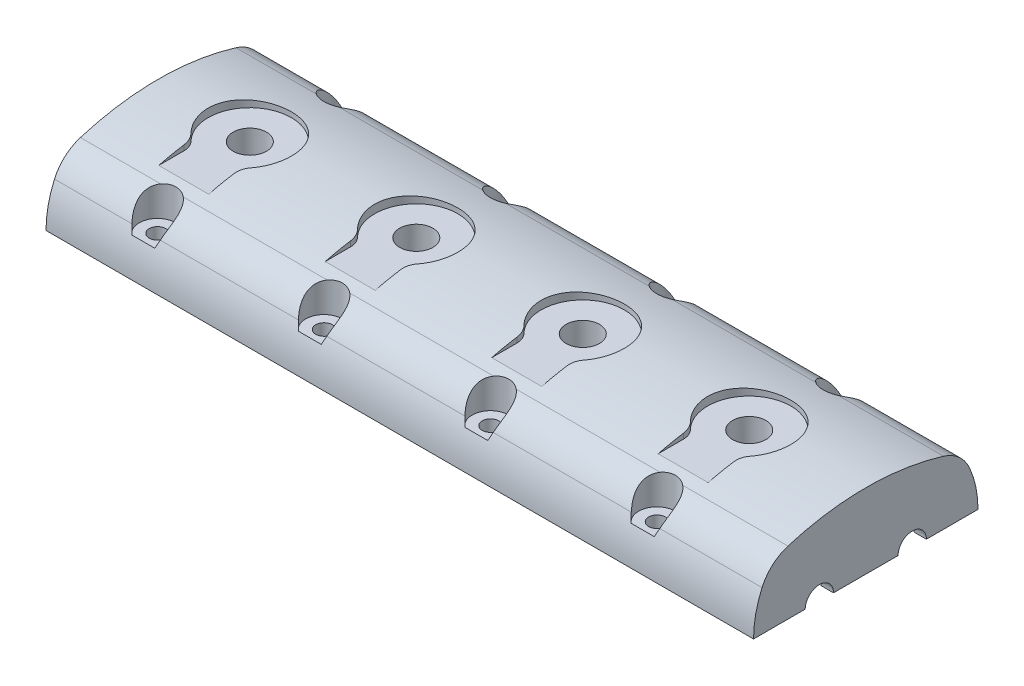
from build123d import *

# Parameters (mm, degrees)
BOSS_EXTRUDE1_DEPTH      = 212.5
BOSS_EXTRUDE1_DEPTH_BACK = 212.5
SHELL1_T                 = -7.5
BOSS_EXTRUDE2_REACH      = 229.432
SKETCH2_R                = 12
BOSS_EXTRUDE4_REACH      = 229.432
SKETCH12_R               = 12
BOSS_EXTRUDE5_DEPTH      = 212
BOSS_EXTRUDE5_DEPTH_BACK = 212
SKETCH3_R                = 11
CUT_EXTRUDE1_DEPTH       = 225.332611468
F_10_0MM_DOWEL_HOLE3_D   = 10
SKETCH18_R               = 12.5
SKETCH18_R_2             = 10
BOSS_EXTRUDE6_DEPTH      = 30
SKETCH19_R               = 10
CUT_EXTRUDE3_DEPTH       = 228.431573519
SKETCH20_W               = 7.5
SKETCH20_H               = 119.816476268
BOSS_EXTRUDE7_DEPTH      = 30
BOSS_EXTRUDE7_2_DEPTH    = 30
BOSS_EXTRUDE7_3_DEPTH    = 30
SPLIT1_START             = 88.75
SPLIT1_DEPTH             = 7.5
SPLIT1_START_2           = -11.25
SPLIT1_2_DEPTH           = 7.5
SPLIT1_START_3           = -111.25
SPLIT1_3_DEPTH           = 7.5
CUT_EXTRUDE2_DEPTH       = 228.431573519
CUT_EXTRUDE2_DEPTH_BACK  = 228.431573519
SKETCH16_R               = 8.5
CUT_EXTRUDE4_DEPTH       = 227.49529936


# Read off the part's stored shape, not the designer's step: Split1
with BuildPart() as part:
    # Sketch1 → Boss-Extrude1 (new, two sides: drawn at the far end of the back side and taken through both)
    with BuildSketch(Plane(origin=(0, 0, 0), x_dir=(0, 0, -1), z_dir=(1, 0, 0)).offset(-BOSS_EXTRUDE1_DEPTH_BACK)):
        with BuildLine():
            Line((-67.408238134, 0), (67.408238134, 0))
            ThreePointArc((67.408238134, 0), (66.121281258, 12.360362739), (62.315619233, 24.190483684))
            ThreePointArc((62.315619233, 24.190483684), (56.03712161, 32.804804676), (46.740792622, 38.020581312))
            ThreePointArc((46.740792622, 38.020581312), (0, 45), (-46.740792622, 38.020581312))
            ThreePointArc((-46.740792622, 38.020581312), (-56.03712161, 32.804804676), (-62.315619233, 24.190483684))
            ThreePointArc((-62.315619233, 24.190483684), (-66.121281258, 12.360362739), (-67.408238134, 0))
        make_face()
    extrude(amount=BOSS_EXTRUDE1_DEPTH + BOSS_EXTRUDE1_DEPTH_BACK)

    # Shell1
    shell1_openings = [part.faces().sort_by_distance(p)[0] for p in [
        (0, 0, 0),
    ]]
    offset(amount=SHELL1_T, openings=shell1_openings, kind=Kind.INTERSECTION)

    # Sketch2 → Boss-Extrude2 (add, up to next)
    with BuildSketch(Plane(origin=(0, 0, 0), x_dir=(1, 0, 0), z_dir=(0, 1, 0)), mode=Mode.PRIVATE) as boss_extrude2_sk1:
        with Locations((-157.5, -55.408238134)):
            Circle(SKETCH2_R)
    boss_extrude2_tool1 = extrude(boss_extrude2_sk1.sketch, amount=BOSS_EXTRUDE2_REACH, mode=Mode.PRIVATE) - part.part
    # Sketch2 → Boss-Extrude2 (add, up to next)
    with BuildSketch(Plane(origin=(0, 0, 0), x_dir=(1, 0, 0), z_dir=(0, 1, 0)), mode=Mode.PRIVATE) as boss_extrude2_sk2:
        with Locations((-57.5, -55.408238134)):
            Circle(SKETCH2_R)
    boss_extrude2_tool2 = extrude(boss_extrude2_sk2.sketch, amount=BOSS_EXTRUDE2_REACH, mode=Mode.PRIVATE) - part.part
    # Sketch2 → Boss-Extrude2 (add, up to next)
    with BuildSketch(Plane(origin=(0, 0, 0), x_dir=(1, 0, 0), z_dir=(0, 1, 0)), mode=Mode.PRIVATE) as boss_extrude2_sk3:
        with Locations((42.5, -55.408238134)):
            Circle(SKETCH2_R)
    boss_extrude2_tool3 = extrude(boss_extrude2_sk3.sketch, amount=BOSS_EXTRUDE2_REACH, mode=Mode.PRIVATE) - part.part
    # Sketch2 → Boss-Extrude2 (add, up to next)
    with BuildSketch(Plane(origin=(0, 0, 0), x_dir=(1, 0, 0), z_dir=(0, 1, 0)), mode=Mode.PRIVATE) as boss_extrude2_sk4:
        with Locations((142.5, -55.408238134)):
            Circle(SKETCH2_R)
    boss_extrude2_tool4 = extrude(boss_extrude2_sk4.sketch, amount=BOSS_EXTRUDE2_REACH, mode=Mode.PRIVATE) - part.part
    add(boss_extrude2_tool1.solids().sort_by_distance((-157.5, 0, 55.408238))[0])
    add(boss_extrude2_tool2.solids().sort_by_distance((-57.5, 0, 55.408238))[0])
    add(boss_extrude2_tool3.solids().sort_by_distance((42.5, 0, 55.408238))[0])
    add(boss_extrude2_tool4.solids().sort_by_distance((142.5, 0, 55.408238))[0])

    # Sketch12 → Boss-Extrude4 (add, up to next)
    with BuildSketch(Plane.XZ, mode=Mode.PRIVATE) as boss_extrude4_sk1:
        with Locations((-157.5, -55.408238134)):
            Circle(SKETCH12_R)
    boss_extrude4_tool1 = extrude(boss_extrude4_sk1.sketch, amount=-BOSS_EXTRUDE4_REACH, mode=Mode.PRIVATE) - part.part
    # Sketch12 → Boss-Extrude4 (add, up to next)
    with BuildSketch(Plane.XZ, mode=Mode.PRIVATE) as boss_extrude4_sk2:
        with Locations((-57.5, -55.408238134)):
            Circle(SKETCH12_R)
    boss_extrude4_tool2 = extrude(boss_extrude4_sk2.sketch, amount=-BOSS_EXTRUDE4_REACH, mode=Mode.PRIVATE) - part.part
    # Sketch12 → Boss-Extrude4 (add, up to next)
    with BuildSketch(Plane.XZ, mode=Mode.PRIVATE) as boss_extrude4_sk3:
        with Locations((42.5, -55.408238134)):
            Circle(SKETCH12_R)
    boss_extrude4_tool3 = extrude(boss_extrude4_sk3.sketch, amount=-BOSS_EXTRUDE4_REACH, mode=Mode.PRIVATE) - part.part
    # Sketch12 → Boss-Extrude4 (add, up to next)
    with BuildSketch(Plane.XZ, mode=Mode.PRIVATE) as boss_extrude4_sk4:
        with Locations((142.5, -55.408238134)):
            Circle(SKETCH12_R)
    boss_extrude4_tool4 = extrude(boss_extrude4_sk4.sketch, amount=-BOSS_EXTRUDE4_REACH, mode=Mode.PRIVATE) - part.part
    add(boss_extrude4_tool1.solids().sort_by_distance((-157.5, 0, -55.408238))[0])
    add(boss_extrude4_tool2.solids().sort_by_distance((-57.5, 0, -55.408238))[0])
    add(boss_extrude4_tool3.solids().sort_by_distance((42.5, 0, -55.408238))[0])
    add(boss_extrude4_tool4.solids().sort_by_distance((142.5, 0, -55.408238))[0])

    # Sketch17 → Boss-Extrude5 (add, two sides: drawn at the far end of the back side and taken through both)
    with BuildSketch(Plane(origin=(0, 0, 0), x_dir=(0, 0, -1), z_dir=(1, 0, 0)).offset(-BOSS_EXTRUDE5_DEPTH_BACK)):
        Polygon((-44.408238134, 36.314981565), (-52.528779147, 30), (52.528779147, 30), (44.408238134, 36.314981565), (0, 42.549434784), align=None)
    extrude(amount=BOSS_EXTRUDE5_DEPTH + BOSS_EXTRUDE5_DEPTH_BACK)

    # Sketch3 → Cut-Extrude1 (cut, through all)
    with BuildSketch(Plane(origin=(0, 20, 0), x_dir=(1, 0, 0), z_dir=(0, 1, 0))):
        with Locations((142.5, -55.408238134)):
            Circle(SKETCH3_R)
        with Locations((-157.5, -55.408238134)):
            Circle(SKETCH3_R)
        with Locations((-57.5, -55.408238134)):
            Circle(SKETCH3_R)
        with Locations((42.5, -55.408238134)):
            Circle(SKETCH3_R)
        with Locations((42.5, 55.408238134)):
            Circle(SKETCH3_R)
        with Locations((-57.5, 55.408238134)):
            Circle(SKETCH3_R)
        with Locations((-157.5, 55.408238134)):
            Circle(SKETCH3_R)
        with Locations((142.5, 55.408238134)):
            Circle(SKETCH3_R)
    extrude(amount=CUT_EXTRUDE1_DEPTH, mode=Mode.SUBTRACT)

    # Ø10.0mm Dowel Hole3 (through all)
    with Locations(Plane(origin=(0, 0, 0), x_dir=(-1, 0, 0), z_dir=(0, -1, 0))):
        with Locations((157.5, -55.408238134), (57.5, -55.408238134), (-42.5, -55.408238134), (-142.5, -55.408238134), (-142.5, 55.408238134), (-42.5, 55.408238134), (57.5, 55.408238134), (157.5, 55.408238134)):
            Hole(F_10_0MM_DOWEL_HOLE3_D / 2)

    # Sketch18 → Boss-Extrude6 (add)
    # profile 1 of 4: a face of its own
    with BuildSketch(Plane(origin=(0, 0, 0), x_dir=(1, 0, 0), z_dir=(0, 1, 0))):
        with Locations(Location((-157.5, 0, 0), (0, 0, 90))):
            Circle(SKETCH18_R)
        with Locations(Location((-157.5, 0, 0), (0, 0, 90))):
            Circle(SKETCH18_R_2, mode=Mode.SUBTRACT)
    # profile 2 of 4: a face of its own
    with BuildSketch(Plane(origin=(0, 0, 0), x_dir=(1, 0, 0), z_dir=(0, 1, 0))):
        with Locations(Location((-57.5, 0, 0), (0, 0, 90))):
            Circle(SKETCH18_R)
        with Locations(Location((-57.5, 0, 0), (0, 0, 90))):
            Circle(SKETCH18_R_2, mode=Mode.SUBTRACT)
    # profile 3 of 4: a face of its own
    with BuildSketch(Plane(origin=(0, 0, 0), x_dir=(1, 0, 0), z_dir=(0, 1, 0))):
        with Locations(Location((42.5, 0, 0), (0, 0, 90))):
            Circle(SKETCH18_R)
        with Locations(Location((42.5, 0, 0), (0, 0, 90))):
            Circle(SKETCH18_R_2, mode=Mode.SUBTRACT)
    # profile 4 of 4: a face of its own
    with BuildSketch(Plane(origin=(0, 0, 0), x_dir=(1, 0, 0), z_dir=(0, 1, 0))):
        with Locations(Location((142.5, 0, 0), (0, 0, 90))):
            Circle(SKETCH18_R)
        with Locations(Location((142.5, 0, 0), (0, 0, 90))):
            Circle(SKETCH18_R_2, mode=Mode.SUBTRACT)
    extrude(amount=BOSS_EXTRUDE6_DEPTH)

    # Sketch19 → Cut-Extrude3 (cut, through all)
    with BuildSketch(Plane(origin=(0, 0, 0), x_dir=(1, 0, 0), z_dir=(0, 1, 0))):
        with Locations((-157.5, 0)):
            Circle(SKETCH19_R)
        with Locations((-57.5, 0)):
            Circle(SKETCH19_R)
        with Locations((42.5, 0)):
            Circle(SKETCH19_R)
        with Locations((142.5, 0)):
            Circle(SKETCH19_R)
    extrude(amount=CUT_EXTRUDE3_DEPTH, mode=Mode.SUBTRACT)


with BuildPart() as body_2:
    # Sketch20 → Boss-Extrude7 (new body)
    with BuildSketch(Plane(origin=(0, 0, 0), x_dir=(1, 0, 0), z_dir=(0, 1, 0))):
        with Locations((-107.5, 0)):
            Rectangle(SKETCH20_W, SKETCH20_H)
    extrude(amount=BOSS_EXTRUDE7_DEPTH)

    # Split1 3 outline → Split1 3 (cut)
    with BuildSketch(Plane.YZ.offset(SPLIT1_START_3)):
        with BuildLine():
            Line((30, -59.908238134), (30, -58.738925818))
            ThreePointArc((30, -58.738925818), (29.242348026, -59.338443294), (28.462097067, -59.908238134))
            Line((28.462097067, -59.908238134), (30, -59.908238134))
        make_face()
        with BuildLine():
            ThreePointArc((28.462097067, 59.908238134), (29.242348026, 59.338443294), (30, 58.738925818))
            Line((30, 58.738925818), (30, 59.908238134))
            Line((30, 59.908238134), (28.462097067, 59.908238134))
        make_face()
    extrude(amount=SPLIT1_3_DEPTH, mode=Mode.SUBTRACT)


with BuildPart() as body_3:
    # Sketch20 → Boss-Extrude7 2 (new body)
    with BuildSketch(Plane(origin=(0, 0, 0), x_dir=(1, 0, 0), z_dir=(0, 1, 0))):
        with Locations((-7.5, 0)):
            Rectangle(SKETCH20_W, SKETCH20_H)
    extrude(amount=BOSS_EXTRUDE7_2_DEPTH)

    # Split1 2 outline → Split1 2 (cut)
    with BuildSketch(Plane.YZ.offset(SPLIT1_START_2)):
        with BuildLine():
            Line((30, -59.908238134), (30, -58.738925818))
            ThreePointArc((30, -58.738925818), (29.242348026, -59.338443294), (28.462097067, -59.908238134))
            Line((28.462097067, -59.908238134), (30, -59.908238134))
        make_face()
        with BuildLine():
            ThreePointArc((28.462097067, 59.908238134), (29.242348026, 59.338443294), (30, 58.738925818))
            Line((30, 58.738925818), (30, 59.908238134))
            Line((30, 59.908238134), (28.462097067, 59.908238134))
        make_face()
    extrude(amount=SPLIT1_2_DEPTH, mode=Mode.SUBTRACT)


with BuildPart() as body_4:
    # Sketch20 → Boss-Extrude7 3 (new body)
    with BuildSketch(Plane(origin=(0, 0, 0), x_dir=(1, 0, 0), z_dir=(0, 1, 0))):
        with Locations((92.5, 0)):
            Rectangle(SKETCH20_W, SKETCH20_H)
    extrude(amount=BOSS_EXTRUDE7_3_DEPTH)

    # Split1 outline → Split1 (cut)
    with BuildSketch(Plane.YZ.offset(SPLIT1_START)):
        with BuildLine():
            Line((30, -59.908238134), (30, -58.738925818))
            ThreePointArc((30, -58.738925818), (29.242348026, -59.338443294), (28.462097067, -59.908238134))
            Line((28.462097067, -59.908238134), (30, -59.908238134))
        make_face()
        with BuildLine():
            ThreePointArc((28.462097067, 59.908238134), (29.242348026, 59.338443294), (30, 58.738925818))
            Line((30, 58.738925818), (30, 59.908238134))
            Line((30, 59.908238134), (28.462097067, 59.908238134))
        make_face()
    extrude(amount=SPLIT1_DEPTH, mode=Mode.SUBTRACT)


with BuildPart() as part_1:
    add(part.part)

    # Combine1: union body 2, body 3, body 4
    add(body_2.part)
    add(body_3.part)
    add(body_4.part)

    # Sketch16 → Cut-Extrude2 (cut, two sides: drawn at the far end of the back side and taken through both)
    with BuildSketch(Plane(origin=(0, 0, 0), x_dir=(0, 0, -1), z_dir=(1, 0, 0)).offset(-CUT_EXTRUDE2_DEPTH_BACK)):
        with Locations((27.896972929, 0)):
            Circle(SKETCH16_R)
        with Locations((-27.896972929, 0)):
            Circle(SKETCH16_R)
    extrude(amount=CUT_EXTRUDE2_DEPTH + CUT_EXTRUDE2_DEPTH_BACK, mode=Mode.SUBTRACT)

    # Sketch21 → Cut-Extrude4 (cut, through all)
    with BuildSketch(Plane(origin=(0, 40, 0), x_dir=(1, 0, 0), z_dir=(0, 1, 0))):
        with BuildLine():
            Line((-172.5, -24.494897428), (-172.5, -45))
            Line((-172.5, -45), (-142.5, -45))
            Line((-142.5, -45), (-142.5, -24.494897428))
            ThreePointArc((-142.5, -24.494897428), (-141.758200998, -20.715252698), (-139.642857143, -17.496355306))
            ThreePointArc((-139.642857143, -17.496355306), (-157.5, 25), (-175.357142857, -17.496355306))
            ThreePointArc((-175.357142857, -17.496355306), (-173.241799002, -20.715252698), (-172.5, -24.494897428))
        make_face()
        with BuildLine():
            Line((-72.5, -24.494897428), (-72.5, -45))
            Line((-72.5, -45), (-42.5, -45))
            Line((-42.5, -45), (-42.5, -24.494897428))
            ThreePointArc((-42.5, -24.494897428), (-41.758200998, -20.715252698), (-39.642857143, -17.496355306))
            ThreePointArc((-39.642857143, -17.496355306), (-57.5, 25), (-75.357142857, -17.496355306))
            ThreePointArc((-75.357142857, -17.496355306), (-73.241799002, -20.715252698), (-72.5, -24.494897428))
        make_face()
        with BuildLine():
            Line((27.5, -24.494897428), (27.5, -45))
            Line((27.5, -45), (57.5, -45))
            Line((57.5, -45), (57.5, -24.494897428))
            ThreePointArc((57.5, -24.494897428), (58.241799002, -20.715252698), (60.357142857, -17.496355306))
            ThreePointArc((60.357142857, -17.496355306), (42.5, 25), (24.642857143, -17.496355306))
            ThreePointArc((24.642857143, -17.496355306), (26.758200998, -20.715252698), (27.5, -24.494897428))
        make_face()
        with BuildLine():
            Line((127.5, -24.494897428), (127.5, -45))
            Line((127.5, -45), (157.5, -45))
            Line((157.5, -45), (157.5, -24.494897428))
            ThreePointArc((157.5, -24.494897428), (158.241799002, -20.715252698), (160.357142857, -17.496355306))
            ThreePointArc((160.357142857, -17.496355306), (142.5, 25), (124.642857143, -17.496355306))
            ThreePointArc((124.642857143, -17.496355306), (126.758200998, -20.715252698), (127.5, -24.494897428))
        make_face()
    extrude(amount=CUT_EXTRUDE4_DEPTH, mode=Mode.SUBTRACT)


solid = part_1.part
